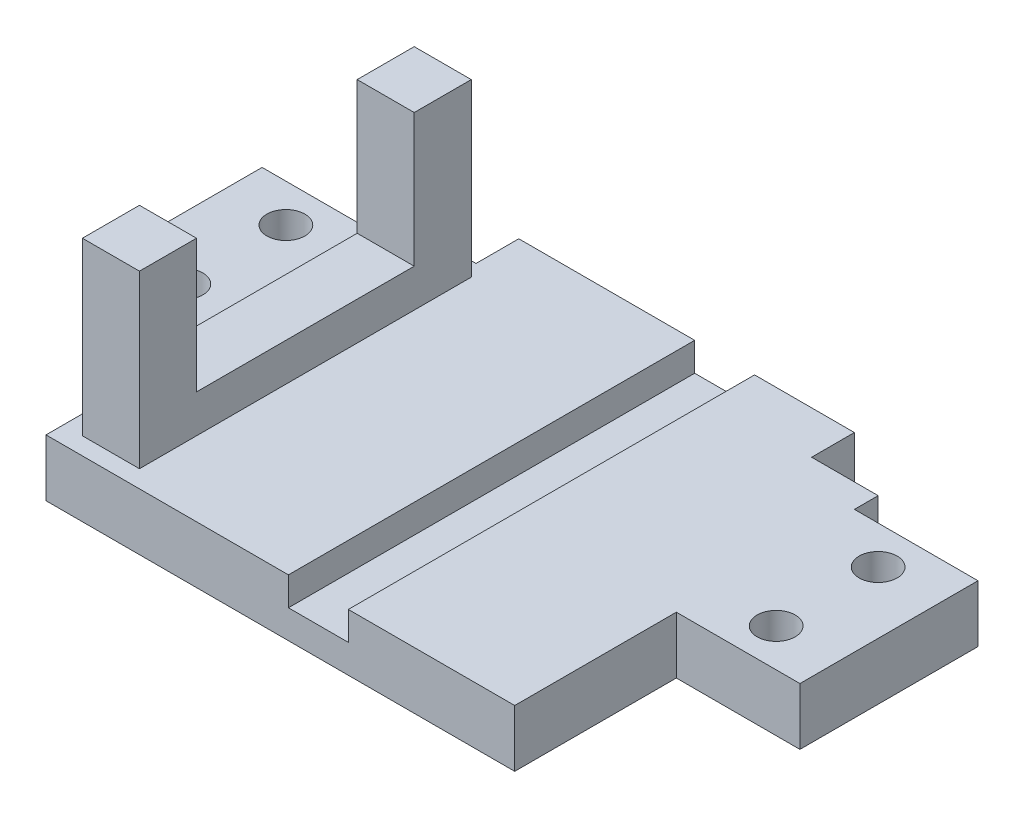
from build123d import *

# Parameters (mm, degrees)
SKETCH_2_W          = 75.3
SKETCH_2_H          = 6
EXTRUDE_1_DEPTH     = 18.73
SKETCH_3_R          = 2
CUT_EXTRUDE_1_DEPTH = 13.73
SKETCH_4_W          = 49.3
SKETCH_4_H          = 6
EXTRUDE_3_DEPTH     = 17
SKETCH_6_W          = 49.3
SKETCH_6_H          = 6
EXTRUDE_5_DEPTH     = 7
SKETCH_7_W          = 6
SKETCH_7_H          = 6
EXTRUDE_6_DEPTH     = 18
SKETCH_8_W          = 6.3
SKETCH_8_H          = 42.73
CUT_EXTRUDE_2_DEPTH = 3
SKETCH_9_W          = 7
SKETCH_9_H          = 4.5
CUT_EXTRUDE_3_DEPTH = 10
SKETCH_10_W         = 6
SKETCH_10_H         = 22.9
EXTRUDE_7_DEPTH     = 4
OTHER_START         = -22.3
OTHER_1_OUTLINE_W   = 6
OTHER_1_OUTLINE_H   = 4.78
OTHER_1_DEPTH       = 5.65
OTHER_1_2_OUTLINE_W = 6
OTHER_1_2_OUTLINE_H = 4.78
OTHER_1_2_DEPTH     = 5.65


# Read off the part's stored shape, not the designer's step: Разделить1, Выступы и прорези-Выступ1, Выступы и прорези-Прорезь1
with BuildPart() as part:
    # Эскиз2 → Бобышка-Вытянуть1 (new body)
    with BuildSketch(Plane.XY):
        Rectangle(SKETCH_2_W, SKETCH_2_H)
    extrude(amount=EXTRUDE_1_DEPTH)

    # Эскиз3 → Вырез-Вытянуть1 (cut)
    with BuildSketch(Plane(origin=(0, 3, 0), x_dir=(1, 0, 0), z_dir=(0, 1, 0))):
        with Locations(Location((-31.15, -4, 0), (0, 0, 270))):
            Circle(SKETCH_3_R)
        with Locations(Location((-31.15, -14.73, 0), (0, 0, 270))):
            Circle(SKETCH_3_R)
        with Locations(Location((31.15, -14.73, 0), (0, 0, 270))):
            Circle(SKETCH_3_R)
        with Locations(Location((31.15, -4, 0), (0, 0, 270))):
            Circle(SKETCH_3_R)
    extrude(amount=-CUT_EXTRUDE_1_DEPTH, mode=Mode.SUBTRACT)

    # Эскиз4 → Бобышка-Вытянуть3 (add)
    with BuildSketch(Plane.XY.offset(18.73)):
        Rectangle(SKETCH_4_W, SKETCH_4_H)
    extrude(amount=EXTRUDE_3_DEPTH)

    # Эскиз6 → Бобышка-Вытянуть5 (add)
    with BuildSketch(Plane(origin=(0, 0, 0), x_dir=(-1, 0, 0), z_dir=(0, 0, -1))):
        Rectangle(SKETCH_6_W, SKETCH_6_H)
    extrude(amount=EXTRUDE_5_DEPTH)

    # Эскиз7 → Бобышка-Вытянуть6 (add)
    with BuildSketch(Plane(origin=(0, 3, 0), x_dir=(1, 0, 0), z_dir=(0, 1, 0))):
        with Locations((-19.65, -2)):
            Rectangle(SKETCH_7_W, SKETCH_7_H)
        with Locations((-19.65, -30.9)):
            Rectangle(SKETCH_7_W, SKETCH_7_H)
    extrude(amount=EXTRUDE_6_DEPTH)

    # Эскиз8 → Вырез-Вытянуть2 (cut)
    with BuildSketch(Plane(origin=(0, 3, -43.99), x_dir=(-1, 0, 0), z_dir=(0, 1, 0))):
        with Locations((-4, 58.355)):
            Rectangle(SKETCH_8_W, SKETCH_8_H)
    extrude(amount=-CUT_EXTRUDE_2_DEPTH, mode=Mode.SUBTRACT)

    # Эскиз9 → Вырез-Вытянуть3 (cut)
    with BuildSketch(Plane(origin=(0, 3, 0), x_dir=(1, 0, 0), z_dir=(0, 1, 0))):
        with Locations((-21.15, 4.75)):
            Rectangle(SKETCH_9_W, SKETCH_9_H)
        with Locations((21.15, 4.75)):
            Rectangle(SKETCH_9_W, SKETCH_9_H)
    extrude(amount=-CUT_EXTRUDE_3_DEPTH, mode=Mode.SUBTRACT)

    # Эскиз10 → Бобышка-Вытянуть7 (add)
    with BuildSketch(Plane(origin=(0, 3, 0), x_dir=(1, 0, 0), z_dir=(0, 1, 0))):
        with Locations((-19.65, -16.45)):
            Rectangle(SKETCH_10_W, SKETCH_10_H)
    extrude(amount=EXTRUDE_7_DEPTH)


with BuildPart() as body_2:
    # Split Bodies 1: the piece on the far side of the plane
    add(part.part)
    split(bisect_by=Plane(origin=(0, 3, 0), x_dir=(1, 0, 0), z_dir=(0, 1, 0)), keep=Keep.BOTTOM)

    # Other 1 2 outline → Other 1 2 (cut)
    with BuildSketch(Plane.YZ.offset(OTHER_START)):
        with Locations((0, 26.51)):
            Rectangle(OTHER_1_2_OUTLINE_W, OTHER_1_2_OUTLINE_H)
        with Locations((0, 16.45)):
            Rectangle(OTHER_1_2_OUTLINE_W, OTHER_1_2_OUTLINE_H)
        with Locations((0, 6.39)):
            Rectangle(OTHER_1_2_OUTLINE_W, OTHER_1_2_OUTLINE_H)
    extrude(amount=OTHER_1_2_DEPTH, mode=Mode.SUBTRACT)


with BuildPart() as part_1:
    add(part.part)

    # Split Bodies 1
    split(bisect_by=Plane(origin=(0, 3, 0), x_dir=(1, 0, 0), z_dir=(0, 1, 0)), keep=Keep.TOP)

    # Other 1 outline → Other 1 (add)
    with BuildSketch(Plane.YZ.offset(OTHER_START)):
        with Locations((0, 6.39)):
            Rectangle(OTHER_1_OUTLINE_W, OTHER_1_OUTLINE_H)
        with Locations((0, 16.45)):
            Rectangle(OTHER_1_OUTLINE_W, OTHER_1_OUTLINE_H)
        with Locations((0, 26.51)):
            Rectangle(OTHER_1_OUTLINE_W, OTHER_1_OUTLINE_H)
    extrude(amount=OTHER_1_DEPTH)


solid = Compound([body_2.part, part_1.part])
